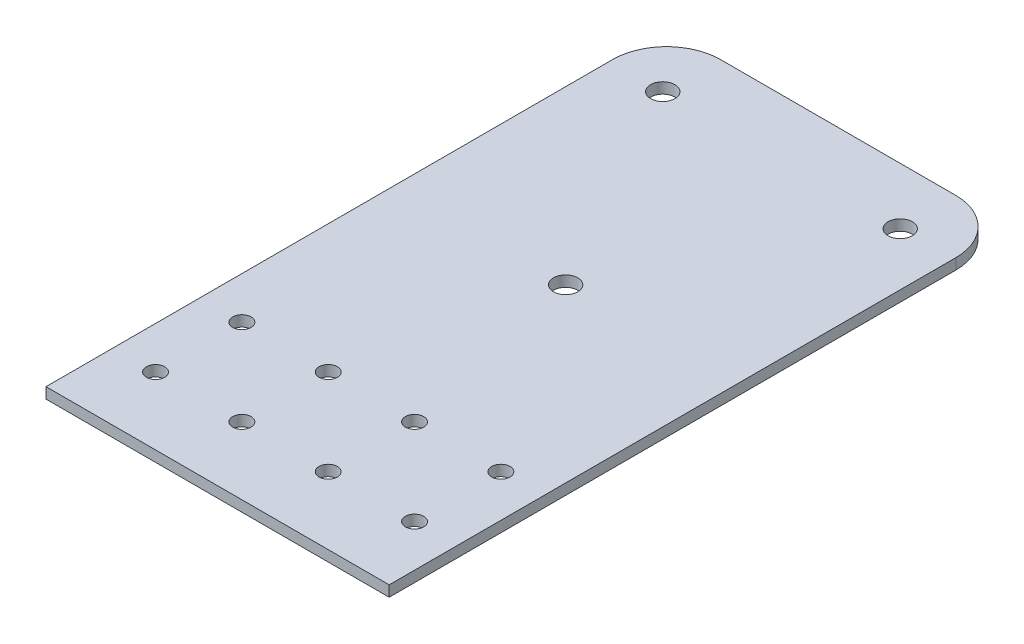
from build123d import *

# Parameters (mm, degrees)
SHEET_EXTRUDE_DEPTH      = 31.8
M3_CLEARANCE_HOLE1_D     = 3.4
M3_CLEARANCE_HOLE1_DEPTH = 8.5
M3_CLEARANCE_HOLE1_TIP   = 1.021463052
M4_CLEARANCE_HOLE1_D     = 4.5
M4_CLEARANCE_HOLE1_DEPTH = 7.5
M4_CLEARANCE_HOLE1_TIP   = 1.351936393
FILLET1_R                = 10


with BuildPart() as part:
    # Sketch2 → Sheet Extrude (new, symmetric)
    with BuildSketch(Plane(origin=(0, 0, 0), x_dir=(0, 0, -1), z_dir=(1, 0, 0))):
        Polygon((0, 0), (0, 2), (-35, 2), (-55, 2), (-115, 2), (-115, 0), (-55, 0), (-35, 0), align=None)
    extrude(amount=SHEET_EXTRUDE_DEPTH, both=True)

    # M3 Clearance Hole1
    with Locations(Plane(origin=(0, 2, 0), x_dir=(1, 0, 0), z_dir=(0, 1, 0))):
        with Locations((-24, -102.5), (-24, -86.5), (-8, -86.5), (-8, -102.5), (24, -102.5), (8, -102.5), (8, -86.5), (24, -86.5)):
            Hole(M3_CLEARANCE_HOLE1_D / 2, depth=M3_CLEARANCE_HOLE1_DEPTH)
            with Locations((0, 0, -(M3_CLEARANCE_HOLE1_DEPTH + M3_CLEARANCE_HOLE1_TIP / 2))):  # 118° drill point
                Cone(0, M3_CLEARANCE_HOLE1_D / 2, M3_CLEARANCE_HOLE1_TIP, mode=Mode.SUBTRACT)

    # M4 Clearance Hole1
    with Locations(Plane(origin=(0, 2, 0), x_dir=(1, 0, 0), z_dir=(0, 1, 0))):
        with Locations((0, -50.5), (22, -10.5), (-22, -10.5)):
            Hole(M4_CLEARANCE_HOLE1_D / 2, depth=M4_CLEARANCE_HOLE1_DEPTH)
            with Locations((0, 0, -(M4_CLEARANCE_HOLE1_DEPTH + M4_CLEARANCE_HOLE1_TIP / 2))):  # 118° drill point
                Cone(0, M4_CLEARANCE_HOLE1_D / 2, M4_CLEARANCE_HOLE1_TIP, mode=Mode.SUBTRACT)

    # Fillet1
    fillet1_edges = [part.edges().sort_by_distance(p)[0] for p in [
        (31.8, 1, 0),
        (-31.8, 1, 0),
    ]]
    fillet(fillet1_edges, radius=FILLET1_R)


solid = part.part
